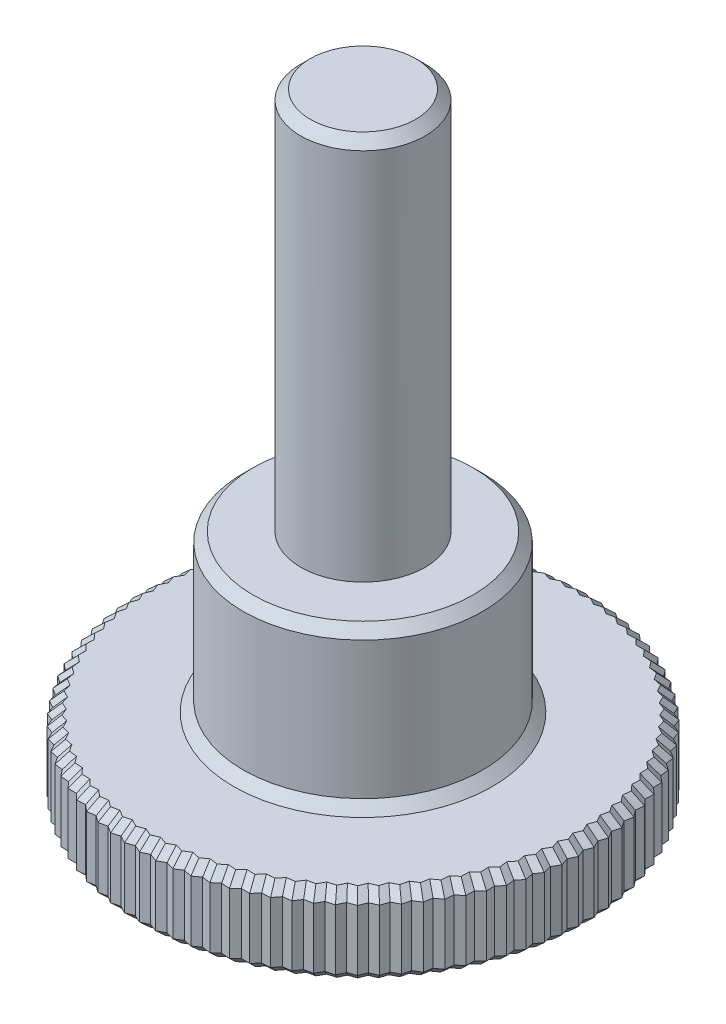
from build123d import *

# Parameters (mm, degrees)
EXTRUDE1_DEPTH = 2.5
SKETCH2_R      = 3.75
EXTRUDE2_DEPTH = 4.9
SKETCH3_R      = 1.95
EXTRUDE3_DEPTH = 12
CHAMFER1_SIZE  = 0.3


with BuildPart() as part:
    # Sketch1 → Extrude1 (new body)
    with BuildSketch(Plane(origin=(0, 0, 0), x_dir=(1, 0, 0), z_dir=(0, 1, 0))):
        Polygon((0.24063377, 6.890849595), (0, 7), (-0.24063377, 6.890849595), (-0.488295316, 6.982948352), (-0.720728967, 6.857278068), (-0.974211707, 6.931876481), (-1.197312845, 6.790298572), (-1.455381836, 6.847033205), (-1.668063535, 6.690237424), (-1.929461491, 6.728831872), (-2.130687588, 6.557582112), (-2.394141003, 6.577848346), (-2.582931144, 6.392978919), (-2.847156502, 6.394818203), (-3.02259092, 6.197229775), (-3.28630094, 6.18063315), (-3.447524936, 5.97128835), (-3.70943485, 5.936336673), (-3.855662958, 5.716255409), (-4.114496766, 5.663118961), (-4.245016577, 5.433373446), (-4.499513268, 5.362311102), (-4.613688902, 5.124020634), (-4.862608593, 5.035378602), (-4.959883799, 4.789704109), (-5.202013778, 4.683914245), (-5.28191464, 4.432052626), (-5.516075275, 4.309630327), (-5.578212524, 4.052808629), (-5.803263008, 3.914350324), (-5.847333918, 3.653819755), (-6.062177826, 3.5), (-6.087967688, 3.237029839), (-6.291558324, 3.068598028), (-6.298941492, 2.804469439), (-6.490286982, 2.622246154), (-6.479227485, 2.358245946), (-6.657395614, 2.163118961), (-6.627947334, 1.900533315), (-6.792070084, 1.693453269), (-6.74437649, 1.433561477), (-6.893654271, 1.215537244), (-6.827947721, 0.959605472), (-6.961653268, 0.731699243), (-6.878253878, 0.480974365), (-6.995735789, 0.244296477), (-6.895049873, 0), (-6.995735789, -0.244296477), (-6.878253878, -0.480974365), (-6.961653268, -0.731699243), (-6.827947721, -0.959605472), (-6.893654271, -1.215537244), (-6.74437649, -1.433561477), (-6.792070084, -1.693453269), (-6.627947334, -1.900533315), (-6.657395614, -2.163118961), (-6.479227485, -2.358245946), (-6.490286982, -2.622246154), (-6.298941492, -2.804469439), (-6.291558324, -3.068598028), (-6.087967688, -3.237029839), (-6.062177826, -3.5), (-5.847333918, -3.653819755), (-5.803263008, -3.914350324), (-5.578212524, -4.052808629), (-5.516075275, -4.309630327), (-5.28191464, -4.432052626), (-5.202013778, -4.683914245), (-4.959883799, -4.789704109), (-4.862608593, -5.035378602), (-4.613688902, -5.124020634), (-4.499513268, -5.362311102), (-4.245016577, -5.433373446), (-4.114496766, -5.663118961), (-3.855662958, -5.716255409), (-3.70943485, -5.936336673), (-3.447524936, -5.97128835), (-3.28630094, -6.18063315), (-3.02259092, -6.197229775), (-2.847156502, -6.394818203), (-2.582931144, -6.392978919), (-2.394141003, -6.577848345), (-2.130687588, -6.557582112), (-1.929461491, -6.728831872), (-1.668063535, -6.690237424), (-1.455381836, -6.847033205), (-1.197312845, -6.790298572), (-0.974211707, -6.931876481), (-0.720728967, -6.857278068), (-0.488295316, -6.982948352), (-0.24063377, -6.890849595), (0, -7), (0.24063377, -6.890849595), (0.488295316, -6.982948352), (0.720728967, -6.857278068), (0.974211707, -6.931876481), (1.197312845, -6.790298572), (1.455381836, -6.847033205), (1.668063535, -6.690237424), (1.929461491, -6.728831872), (2.130687588, -6.557582112), (2.394141003, -6.577848345), (2.582931144, -6.392978919), (2.847156502, -6.394818203), (3.02259092, -6.197229775), (3.28630094, -6.18063315), (3.447524936, -5.97128835), (3.70943485, -5.936336673), (3.855662958, -5.716255409), (4.114496766, -5.663118961), (4.245016577, -5.433373446), (4.499513268, -5.362311102), (4.613688902, -5.124020634), (4.862608593, -5.035378602), (4.959883799, -4.789704109), (5.202013778, -4.683914245), (5.28191464, -4.432052626), (5.516075275, -4.309630327), (5.578212524, -4.052808629), (5.803263008, -3.914350324), (5.847333918, -3.653819755), (6.062177826, -3.5), (6.087967688, -3.237029839), (6.291558324, -3.068598028), (6.298941492, -2.804469439), (6.490286982, -2.622246154), (6.479227485, -2.358245946), (6.657395614, -2.163118961), (6.627947334, -1.900533315), (6.792070084, -1.693453269), (6.74437649, -1.433561477), (6.893654271, -1.215537244), (6.827947721, -0.959605472), (6.961653268, -0.731699243), (6.878253878, -0.480974365), (6.995735789, -0.244296477), (6.895049873, 0), (6.995735789, 0.244296477), (6.878253878, 0.480974365), (6.961653268, 0.731699243), (6.827947721, 0.959605472), (6.893654271, 1.215537244), (6.74437649, 1.433561477), (6.792070084, 1.693453269), (6.627947334, 1.900533315), (6.657395614, 2.163118961), (6.479227485, 2.358245946), (6.490286982, 2.622246154), (6.298941492, 2.804469439), (6.291558324, 3.068598028), (6.087967688, 3.237029839), (6.062177826, 3.5), (5.847333918, 3.653819755), (5.803263008, 3.914350324), (5.578212524, 4.052808629), (5.516075275, 4.309630327), (5.28191464, 4.432052626), (5.202013778, 4.683914245), (4.959883799, 4.789704109), (4.862608593, 5.035378602), (4.613688902, 5.124020634), (4.499513268, 5.362311102), (4.245016577, 5.433373446), (4.114496766, 5.663118961), (3.855662958, 5.716255409), (3.70943485, 5.936336673), (3.447524936, 5.97128835), (3.28630094, 6.18063315), (3.02259092, 6.197229775), (2.847156502, 6.394818203), (2.582931144, 6.392978919), (2.394141003, 6.577848346), (2.130687588, 6.557582112), (1.929461491, 6.728831872), (1.668063535, 6.690237424), (1.455381836, 6.847033205), (1.197312845, 6.790298572), (0.974211707, 6.931876481), (0.720728967, 6.857278068), (0.488295316, 6.982948352), align=None)
    extrude(amount=EXTRUDE1_DEPTH)

    # Sketch2 → Extrude2 (add)
    with BuildSketch(Plane(origin=(0, 2.5, 0), x_dir=(1, 0, 0), z_dir=(0, 1, 0))):
        Circle(SKETCH2_R)
    extrude(amount=EXTRUDE2_DEPTH)

    # Sketch3 → Extrude3 (add)
    with BuildSketch(Plane(origin=(0, 7.4, 0), x_dir=(1, 0, 0), z_dir=(0, 1, 0))):
        Circle(SKETCH3_R)
    extrude(amount=EXTRUDE3_DEPTH)

    # Chamfer1
    chamfer1_edges = [part.edges().sort_by_distance(p)[0] for p in [
        (0.364464543, 2.5, -6.936898973),
        (0.604512142, 2.5, -6.92011321),
        (0.847470337, 2.5, -6.894577275),
        (1.085762276, 2.5, -6.861087527),
        (1.326347341, 2.5, -6.818665889),
        (1.561722686, 2.5, -6.768635315),
        (1.798762513, 2.5, -6.709534648),
        (2.030074539, 2.5, -6.643206992),
        (2.262414296, 2.5, -6.567715229),
        (2.488536074, 2.5, -6.485413632),
        (2.715043823, 2.5, -6.393898561),
        (2.934873711, 2.5, -6.296023989),
        (3.15444593, 2.5, -6.188931462),
        (3.366912938, 2.5, -6.07596075),
        (3.578479893, 2.5, -5.953812512),
        (3.782548904, 2.5, -5.826296041),
        (3.985079862, 2.5, -5.689687185),
        (4.179756672, 2.5, -5.548246204),
        (4.372264922, 2.5, -5.397842274),
        (4.556601085, 2.5, -5.243165868),
        (4.738148748, 2.5, -5.079699618),
        (4.911246196, 2.5, -4.912541356),
        (5.080948789, 2.5, -4.736809177),
        (5.241964209, 2.5, -4.557983435),
        (5.398994958, 2.5, -4.370841477),
        (5.5471439, 2.5, -4.181219478),
        (5.690737766, 2.5, -3.983579477),
        (5.825298463, 2.5, -3.78408504),
        (5.954755872, 2.5, -3.576909878),
        (6.075072757, 2.5, -3.36851492),
        (6.189763006, 2.5, -3.152813933),
        (6.295249908, 2.5, -2.936533733),
        (6.394614237, 2.5, -2.713357797),
        (6.484757234, 2.5, -2.49024605),
        (6.56831155, 2.5, -2.260682453),
        (6.642671474, 2.5, -2.031826138),
        (6.710008709, 2.5, -1.796993292),
        (6.768223287, 2.5, -1.563507373),
        (6.819015381, 2.5, -1.324549361),
        (6.860800996, 2.5, -1.087571358),
        (6.894800495, 2.5, -0.845652357),
        (6.919953573, 2.5, -0.606336804),
        (6.936994834, 2.5, -0.362635421),
        (6.945392831, 2.5, -0.122148238),
        (6.945392831, 2.5, 0.122148238),
        (6.936994834, 2.5, 0.362635421),
        (6.919953573, 2.5, 0.606336804),
        (6.894800495, 2.5, 0.845652357),
        (6.860800996, 2.5, 1.087571358),
        (6.819015381, 2.5, 1.324549361),
        (6.768223287, 2.5, 1.563507373),
        (6.710008709, 2.5, 1.796993292),
        (6.642671474, 2.5, 2.031826138),
        (6.56831155, 2.5, 2.260682453),
        (6.484757234, 2.5, 2.49024605),
        (6.394614237, 2.5, 2.713357797),
        (6.295249908, 2.5, 2.936533733),
        (6.189763006, 2.5, 3.152813933),
        (6.075072757, 2.5, 3.36851492),
        (5.954755872, 2.5, 3.576909878),
        (5.825298463, 2.5, 3.78408504),
        (5.690737766, 2.5, 3.983579477),
        (5.5471439, 2.5, 4.181219478),
        (5.398994958, 2.5, 4.370841477),
        (5.241964209, 2.5, 4.557983435),
        (5.080948789, 2.5, 4.736809177),
        (4.911246196, 2.5, 4.912541356),
        (4.738148748, 2.5, 5.079699618),
        (4.556601085, 2.5, 5.243165868),
        (4.372264922, 2.5, 5.397842274),
        (4.179756672, 2.5, 5.548246204),
        (3.985079862, 2.5, 5.689687185),
        (3.782548904, 2.5, 5.826296041),
        (3.578479893, 2.5, 5.953812512),
        (3.366912938, 2.5, 6.07596075),
        (3.15444593, 2.5, 6.188931462),
        (2.934873711, 2.5, 6.296023989),
        (2.715043823, 2.5, 6.393898561),
        (2.488536074, 2.5, 6.485413632),
        (2.262414296, 2.5, 6.567715229),
        (2.030074539, 2.5, 6.643206992),
        (1.798762513, 2.5, 6.709534648),
        (1.561722686, 2.5, 6.768635315),
        (1.326347341, 2.5, 6.818665889),
        (1.085762276, 2.5, 6.861087527),
        (0.847470337, 2.5, 6.894577275),
        (0.604512142, 2.5, 6.92011321),
        (0.364464543, 2.5, 6.936898973),
        (0.120316885, 2.5, 6.945424797),
        (-0.120316885, 2.5, 6.945424797),
        (-0.364464543, 2.5, 6.936898973),
        (-0.604512142, 2.5, 6.92011321),
        (-0.847470337, 2.5, 6.894577275),
        (-1.085762276, 2.5, 6.861087527),
        (-1.326347341, 2.5, 6.818665889),
        (-1.561722686, 2.5, 6.768635315),
        (-1.798762513, 2.5, 6.709534648),
        (-2.030074539, 2.5, 6.643206992),
        (-2.262414296, 2.5, 6.567715229),
        (-2.488536074, 2.5, 6.485413632),
        (-2.715043823, 2.5, 6.393898561),
        (-2.934873711, 2.5, 6.296023989),
        (-3.15444593, 2.5, 6.188931462),
        (-3.366912938, 2.5, 6.07596075),
        (-3.578479893, 2.5, 5.953812512),
        (-3.782548904, 2.5, 5.826296041),
        (-3.985079862, 2.5, 5.689687185),
        (-4.179756672, 2.5, 5.548246204),
        (-4.372264922, 2.5, 5.397842274),
        (-4.556601085, 2.5, 5.243165868),
        (-4.738148748, 2.5, 5.079699618),
        (-4.911246196, 2.5, 4.912541356),
        (-5.080948789, 2.5, 4.736809177),
        (-5.241964209, 2.5, 4.557983435),
        (-5.398994958, 2.5, 4.370841477),
        (-5.5471439, 2.5, 4.181219478),
        (-5.690737766, 2.5, 3.983579477),
        (-5.825298463, 2.5, 3.78408504),
        (-5.954755872, 2.5, 3.576909878),
        (-6.075072757, 2.5, 3.36851492),
        (-6.189763006, 2.5, 3.152813933),
        (-6.295249908, 2.5, 2.936533733),
        (-6.394614237, 2.5, 2.713357797),
        (-6.484757234, 2.5, 2.49024605),
        (-6.56831155, 2.5, 2.260682453),
        (-6.642671474, 2.5, 2.031826138),
        (-6.710008709, 2.5, 1.796993292),
        (-6.768223287, 2.5, 1.563507373),
        (-6.819015381, 2.5, 1.324549361),
        (-6.860800996, 2.5, 1.087571358),
        (-6.894800495, 2.5, 0.845652357),
        (-6.919953573, 2.5, 0.606336804),
        (-6.936994834, 2.5, 0.362635421),
        (-6.945392831, 2.5, 0.122148238),
        (-6.945392831, 2.5, -0.122148238),
        (-6.936994834, 2.5, -0.362635421),
        (-6.919953573, 2.5, -0.606336804),
        (-6.894800495, 2.5, -0.845652357),
        (-6.860800996, 2.5, -1.087571358),
        (-6.819015381, 2.5, -1.324549361),
        (-6.768223287, 2.5, -1.563507373),
        (-6.710008709, 2.5, -1.796993292),
        (-6.642671474, 2.5, -2.031826138),
        (-6.56831155, 2.5, -2.260682453),
        (-6.484757234, 2.5, -2.49024605),
        (-6.394614237, 2.5, -2.713357797),
        (-6.295249908, 2.5, -2.936533733),
        (-6.189763006, 2.5, -3.152813933),
        (-6.075072757, 2.5, -3.36851492),
        (-5.954755872, 2.5, -3.576909878),
        (-5.825298463, 2.5, -3.78408504),
        (-5.690737766, 2.5, -3.983579477),
        (-5.5471439, 2.5, -4.181219478),
        (-5.398994958, 2.5, -4.370841477),
        (-5.241964209, 2.5, -4.557983435),
        (-5.080948789, 2.5, -4.736809177),
        (-4.911246196, 2.5, -4.912541356),
        (-4.738148748, 2.5, -5.079699618),
        (-4.556601085, 2.5, -5.243165868),
        (-4.372264922, 2.5, -5.397842274),
        (-4.179756672, 2.5, -5.548246204),
        (-3.985079862, 2.5, -5.689687185),
        (-3.782548904, 2.5, -5.826296041),
        (-3.578479893, 2.5, -5.953812512),
        (-3.366912938, 2.5, -6.07596075),
        (-3.15444593, 2.5, -6.188931462),
        (-2.934873711, 2.5, -6.296023989),
        (-2.715043823, 2.5, -6.393898561),
        (-2.488536074, 2.5, -6.485413632),
        (-2.262414296, 2.5, -6.567715229),
        (-2.030074539, 2.5, -6.643206992),
        (-1.798762513, 2.5, -6.709534648),
        (-1.561722686, 2.5, -6.768635315),
        (-1.326347341, 2.5, -6.818665889),
        (-1.085762276, 2.5, -6.861087527),
        (-0.847470337, 2.5, -6.894577275),
        (-0.604512142, 2.5, -6.92011321),
        (-0.364464543, 2.5, -6.936898973),
        (-0.120316885, 2.5, -6.945424797),
        (0.120316885, 2.5, -6.945424797),
        (-3.75, 2.5, 0),
        (-0.120316885, 0, -6.945424797),
        (-0.364464543, 0, -6.936898973),
        (-0.604512142, 0, -6.92011321),
        (-0.847470337, 0, -6.894577275),
        (-1.085762276, 0, -6.861087527),
        (-1.326347341, 0, -6.818665889),
        (-1.561722686, 0, -6.768635315),
        (-1.798762513, 0, -6.709534648),
        (-2.030074539, 0, -6.643206992),
        (-2.262414296, 0, -6.567715229),
        (-2.488536074, 0, -6.485413632),
        (-2.715043823, 0, -6.393898561),
        (-2.934873711, 0, -6.296023989),
        (-3.15444593, 0, -6.188931462),
        (-3.366912938, 0, -6.07596075),
        (-3.578479893, 0, -5.953812512),
        (-3.782548904, 0, -5.826296041),
        (-3.985079862, 0, -5.689687185),
        (-4.179756672, 0, -5.548246204),
        (-4.372264922, 0, -5.397842274),
        (-4.556601085, 0, -5.243165868),
        (-4.738148748, 0, -5.079699618),
        (-4.911246196, 0, -4.912541356),
        (-5.080948789, 0, -4.736809177),
        (-5.241964209, 0, -4.557983435),
        (-5.398994958, 0, -4.370841477),
        (-5.5471439, 0, -4.181219478),
        (-5.690737766, 0, -3.983579477),
        (-5.825298463, 0, -3.78408504),
        (-5.954755872, 0, -3.576909878),
        (-6.075072757, 0, -3.36851492),
        (-6.189763006, 0, -3.152813933),
        (-6.295249908, 0, -2.936533733),
        (-6.394614237, 0, -2.713357797),
        (-6.484757234, 0, -2.49024605),
        (-6.56831155, 0, -2.260682453),
        (-6.642671474, 0, -2.031826138),
        (-6.710008709, 0, -1.796993292),
        (-6.768223287, 0, -1.563507373),
        (-6.819015381, 0, -1.324549361),
        (-6.860800996, 0, -1.087571358),
        (-6.894800495, 0, -0.845652357),
        (-6.919953573, 0, -0.606336804),
        (-6.936994834, 0, -0.362635421),
        (-6.945392831, 0, -0.122148238),
        (-6.945392831, 0, 0.122148238),
        (-6.936994834, 0, 0.362635421),
        (-6.919953573, 0, 0.606336804),
        (-6.894800495, 0, 0.845652357),
        (-6.860800996, 0, 1.087571358),
        (-6.819015381, 0, 1.324549361),
        (-6.768223287, 0, 1.563507373),
        (-6.710008709, 0, 1.796993292),
        (-6.642671474, 0, 2.031826138),
        (-6.56831155, 0, 2.260682453),
        (-6.484757234, 0, 2.49024605),
        (-6.394614237, 0, 2.713357797),
        (-6.295249908, 0, 2.936533733),
        (-6.189763006, 0, 3.152813933),
        (-6.075072757, 0, 3.36851492),
        (-5.954755872, 0, 3.576909878),
        (-5.825298463, 0, 3.78408504),
        (-5.690737766, 0, 3.983579477),
        (-5.5471439, 0, 4.181219478),
        (-5.398994958, 0, 4.370841477),
        (-5.241964209, 0, 4.557983435),
        (-5.080948789, 0, 4.736809177),
        (-4.911246196, 0, 4.912541356),
        (-4.738148748, 0, 5.079699618),
        (-4.556601085, 0, 5.243165868),
        (-4.372264922, 0, 5.397842274),
        (-4.179756672, 0, 5.548246204),
        (-3.985079862, 0, 5.689687185),
        (-3.782548904, 0, 5.826296041),
        (-3.578479893, 0, 5.953812512),
        (-3.366912938, 0, 6.07596075),
        (-3.15444593, 0, 6.188931462),
        (-2.934873711, 0, 6.296023989),
        (-2.715043823, 0, 6.393898561),
        (-2.488536074, 0, 6.485413632),
        (-2.262414296, 0, 6.567715229),
        (-2.030074539, 0, 6.643206992),
        (-1.798762513, 0, 6.709534648),
        (-1.561722686, 0, 6.768635315),
        (-1.326347341, 0, 6.818665889),
        (-1.085762276, 0, 6.861087527),
        (-0.847470337, 0, 6.894577275),
        (-0.604512142, 0, 6.92011321),
        (-0.364464543, 0, 6.936898973),
        (-0.120316885, 0, 6.945424797),
        (0.120316885, 0, 6.945424797),
        (0.364464543, 0, 6.936898973),
        (0.604512142, 0, 6.92011321),
        (0.847470337, 0, 6.894577275),
        (1.085762276, 0, 6.861087527),
        (1.326347341, 0, 6.818665889),
        (1.561722686, 0, 6.768635315),
        (1.798762513, 0, 6.709534648),
        (2.030074539, 0, 6.643206992),
        (2.262414296, 0, 6.567715229),
        (2.488536074, 0, 6.485413632),
        (2.715043823, 0, 6.393898561),
        (2.934873711, 0, 6.296023989),
        (3.15444593, 0, 6.188931462),
        (3.366912938, 0, 6.07596075),
        (3.578479893, 0, 5.953812512),
        (3.782548904, 0, 5.826296041),
        (3.985079862, 0, 5.689687185),
        (4.179756672, 0, 5.548246204),
        (4.372264922, 0, 5.397842274),
        (4.556601085, 0, 5.243165868),
        (4.738148748, 0, 5.079699618),
        (4.911246196, 0, 4.912541356),
        (5.080948789, 0, 4.736809177),
        (5.241964209, 0, 4.557983435),
        (5.398994958, 0, 4.370841477),
        (5.5471439, 0, 4.181219478),
        (5.690737766, 0, 3.983579477),
        (5.825298463, 0, 3.78408504),
        (5.954755872, 0, 3.576909878),
        (6.075072757, 0, 3.36851492),
        (6.189763006, 0, 3.152813933),
        (6.295249908, 0, 2.936533733),
        (6.394614237, 0, 2.713357797),
        (6.484757234, 0, 2.49024605),
        (6.56831155, 0, 2.260682453),
        (6.642671474, 0, 2.031826138),
        (6.710008709, 0, 1.796993292),
        (6.768223287, 0, 1.563507373),
        (6.819015381, 0, 1.324549361),
        (6.860800996, 0, 1.087571358),
        (6.894800495, 0, 0.845652357),
        (6.919953573, 0, 0.606336804),
        (6.936994834, 0, 0.362635421),
        (6.945392831, 0, 0.122148238),
        (6.945392831, 0, -0.122148238),
        (6.936994834, 0, -0.362635421),
        (6.919953573, 0, -0.606336804),
        (6.894800495, 0, -0.845652357),
        (6.860800996, 0, -1.087571358),
        (6.819015381, 0, -1.324549361),
        (6.768223287, 0, -1.563507373),
        (6.710008709, 0, -1.796993292),
        (6.642671474, 0, -2.031826138),
        (6.56831155, 0, -2.260682453),
        (6.484757234, 0, -2.49024605),
        (6.394614237, 0, -2.713357797),
        (6.295249908, 0, -2.936533733),
        (6.189763006, 0, -3.152813933),
        (6.075072757, 0, -3.36851492),
        (5.954755872, 0, -3.576909878),
        (5.825298463, 0, -3.78408504),
        (5.690737766, 0, -3.983579477),
        (5.5471439, 0, -4.181219478),
        (5.398994958, 0, -4.370841477),
        (5.241964209, 0, -4.557983435),
        (5.080948789, 0, -4.736809177),
        (4.911246196, 0, -4.912541356),
        (4.738148748, 0, -5.079699618),
        (4.556601085, 0, -5.243165868),
        (4.372264922, 0, -5.397842274),
        (4.179756672, 0, -5.548246204),
        (3.985079862, 0, -5.689687185),
        (3.782548904, 0, -5.826296041),
        (3.578479893, 0, -5.953812512),
        (3.366912938, 0, -6.07596075),
        (3.15444593, 0, -6.188931462),
        (2.934873711, 0, -6.296023989),
        (2.715043823, 0, -6.393898561),
        (2.488536074, 0, -6.485413632),
        (2.262414296, 0, -6.567715229),
        (2.030074539, 0, -6.643206992),
        (1.798762513, 0, -6.709534648),
        (1.561722686, 0, -6.768635315),
        (1.326347341, 0, -6.818665889),
        (1.085762276, 0, -6.861087527),
        (0.847470337, 0, -6.894577275),
        (0.604512142, 0, -6.92011321),
        (0.364464543, 0, -6.936898973),
        (0.120316885, 0, -6.945424797),
        (-1.95, 19.4, 0),
        (-3.75, 7.4, 0),
    ]]
    chamfer(chamfer1_edges, length=CHAMFER1_SIZE)


solid = part.part
